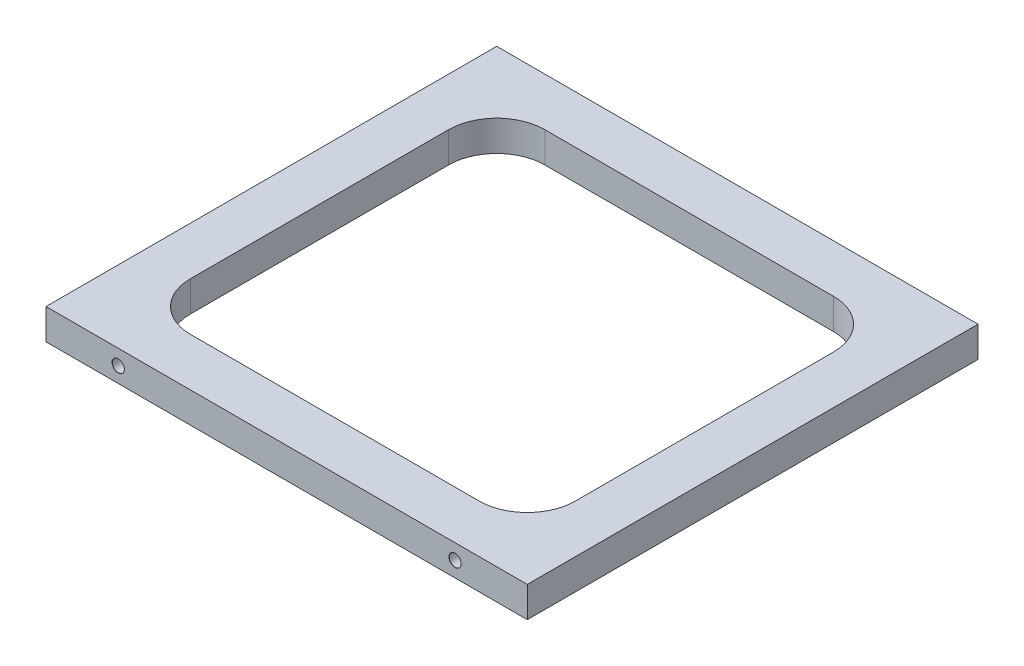
from build123d import *

# Parameters (mm, degrees)
SKETCH1_W                             = 100
SKETCH1_H                             = 93.65
BOSS_EXTRUDE1_DEPTH                   = 6.35
TAP_DRILL_FOR_M3X0_5_TAP1_D           = 2.5
TAP_DRILL_FOR_M3X0_5_TAP1_DEPTH       = 9.248924226
TAP_DRILL_FOR_M3X0_5_TAP1_CSINK_D     = 2.55
TAP_DRILL_FOR_M3X0_5_TAP1_CSINK_ANGLE = 90
TAP_DRILL_FOR_M3X0_5_TAP1_TIP         = 0.751075774
TAP_DRILL_FOR_M3X0_5_TAP2_D           = 2.5
TAP_DRILL_FOR_M3X0_5_TAP2_DEPTH       = 9.248924226
TAP_DRILL_FOR_M3X0_5_TAP2_CSINK_D     = 2.55
TAP_DRILL_FOR_M3X0_5_TAP2_CSINK_ANGLE = 90
TAP_DRILL_FOR_M3X0_5_TAP2_TIP         = 0.751075774
CUT_EXTRUDE1_DEPTH                    = 6.35


with BuildPart() as part:
    # Sketch1 → Boss-Extrude1 (new body)
    with BuildSketch(Plane(origin=(0, 0, 0), x_dir=(1, 0, 0), z_dir=(0, 1, 0))):
        Rectangle(SKETCH1_W, SKETCH1_H)
    extrude(amount=BOSS_EXTRUDE1_DEPTH)

    # Tap Drill for M3x0.5 Tap1
    with Locations(Plane.XY.offset(46.825)):
        with Locations((-35, 3.175), (35, 3.175)):
            CounterSinkHole(TAP_DRILL_FOR_M3X0_5_TAP1_D / 2, TAP_DRILL_FOR_M3X0_5_TAP1_CSINK_D / 2, depth=TAP_DRILL_FOR_M3X0_5_TAP1_DEPTH, counter_sink_angle=TAP_DRILL_FOR_M3X0_5_TAP1_CSINK_ANGLE)
            with Locations((0, 0, -(TAP_DRILL_FOR_M3X0_5_TAP1_DEPTH + TAP_DRILL_FOR_M3X0_5_TAP1_TIP / 2))):  # 118° drill point
                Cone(0, TAP_DRILL_FOR_M3X0_5_TAP1_D / 2, TAP_DRILL_FOR_M3X0_5_TAP1_TIP, mode=Mode.SUBTRACT)

    # Tap Drill for M3x0.5 Tap2
    with Locations(Plane(origin=(0, 0, -46.825), x_dir=(-1, 0, 0), z_dir=(0, 0, -1))):
        with Locations((-35, 3.175), (35, 3.175)):
            CounterSinkHole(TAP_DRILL_FOR_M3X0_5_TAP2_D / 2, TAP_DRILL_FOR_M3X0_5_TAP2_CSINK_D / 2, depth=TAP_DRILL_FOR_M3X0_5_TAP2_DEPTH, counter_sink_angle=TAP_DRILL_FOR_M3X0_5_TAP2_CSINK_ANGLE)
            with Locations((0, 0, -(TAP_DRILL_FOR_M3X0_5_TAP2_DEPTH + TAP_DRILL_FOR_M3X0_5_TAP2_TIP / 2))):  # 118° drill point
                Cone(0, TAP_DRILL_FOR_M3X0_5_TAP2_D / 2, TAP_DRILL_FOR_M3X0_5_TAP2_TIP, mode=Mode.SUBTRACT)

    # Sketch8 → Cut-Extrude1 (cut)
    with BuildSketch(Plane(origin=(0, 6.35, 0), x_dir=(1, 0, 0), z_dir=(0, 1, 0))):
        with BuildLine():
            Line((-30, 36.825), (30, 36.825))
            ThreePointArc((30, 36.825), (37.071067812, 33.896067812), (40, 26.825))
            Line((40, 26.825), (40, -26.825))
            ThreePointArc((40, -26.825), (37.071067812, -33.896067812), (30, -36.825))
            Line((30, -36.825), (-30, -36.825))
            ThreePointArc((-30, -36.825), (-37.071067812, -33.896067812), (-40, -26.825))
            Line((-40, -26.825), (-40, 26.825))
            ThreePointArc((-40, 26.825), (-37.071067812, 33.896067812), (-30, 36.825))
        make_face()
    extrude(amount=-CUT_EXTRUDE1_DEPTH, mode=Mode.SUBTRACT)


solid = part.part
